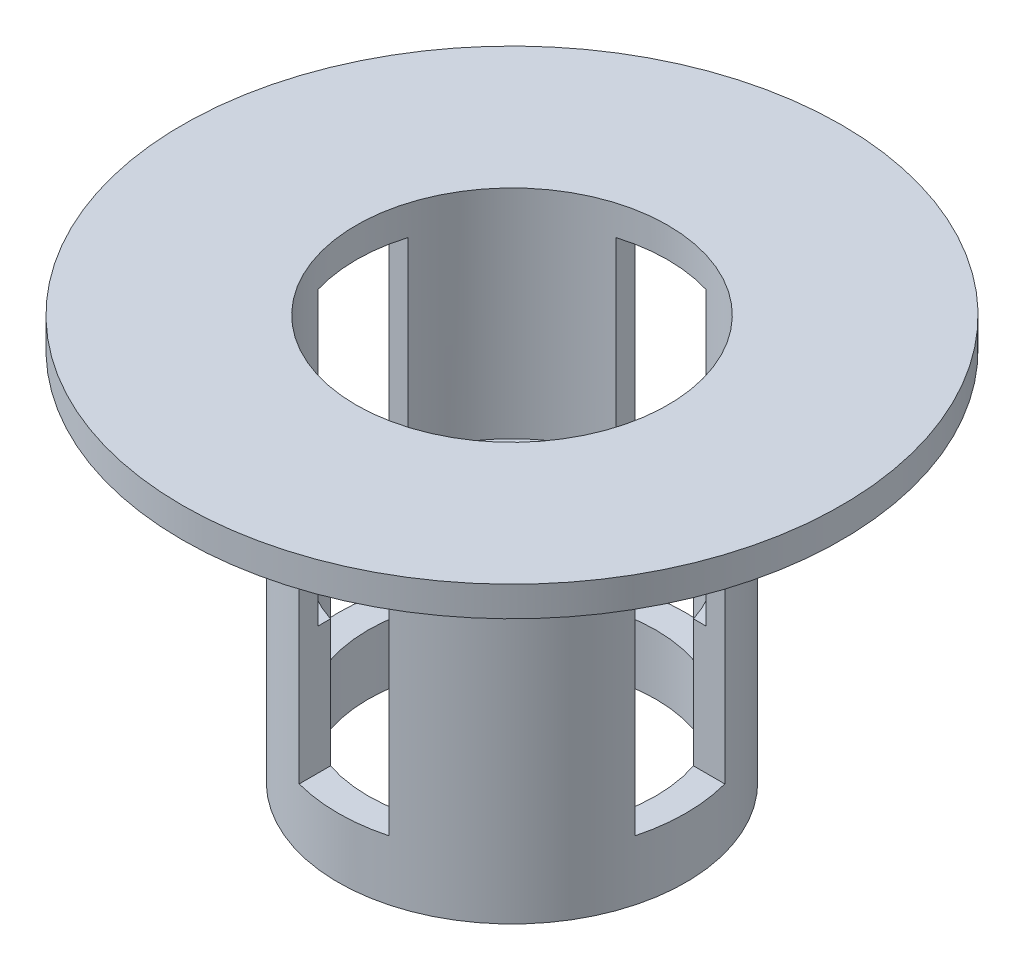
from build123d import *
from build123d.topology import SkipClean

# Parameters (mm, degrees)
SKETCH1_R          = 13.97
SKETCH1_R_2        = 6.604
STABILIZER_DEPTH   = 1.27
LARGE_START        = 7.9375
SKETCH2_R          = 7.366
SKETCH2_R_2        = 6.604
LARGE_END_DEPTH    = 7.9375
SMALL_START        = 7.9375
SKETCH3_R          = 7.366
SKETCH3_R_2        = 6.096
SMALL_END_DEPTH    = 7.9375
SKETCH5_W          = 3.81
SKETCH5_H          = 13.335
CUT_EXTRUDE1_DEPTH = 31.730063798
SKETCH7_W          = 3.81
SKETCH7_H          = 13.335
CUT_EXTRUDE2_DEPTH = 31.730063798


with BuildPart() as part:
    # Sketch1 → Stabilizer (new body)
    with BuildSketch(Plane(origin=(0, 0, 0), x_dir=(1, 0, 0), z_dir=(0, 1, 0))):
        Circle(SKETCH1_R)
        Circle(SKETCH1_R_2, mode=Mode.SUBTRACT)
    extrude(amount=STABILIZER_DEPTH)

    # Sketch2 → Large End (add)
    with SkipClean():  # the faces are left unmerged after this step: merging them gives an invalid solid
        with BuildSketch(Plane(origin=(0, 0, 0), x_dir=(-1, 0, 0), z_dir=(0, -1, 0)).offset(LARGE_START)):
            Circle(SKETCH2_R)
            Circle(SKETCH2_R_2, mode=Mode.SUBTRACT)
        extrude(amount=-LARGE_END_DEPTH)

    # Sketch3 → Small End (add)
    with SkipClean():  # the faces are left unmerged after this step: merging them gives an invalid solid
        with BuildSketch(Plane(origin=(0, -7.9375, 0), x_dir=(-1, 0, 0), z_dir=(0, -1, 0)).offset(SMALL_START)):
            Circle(SKETCH3_R)
            Circle(SKETCH3_R_2, mode=Mode.SUBTRACT)
        extrude(amount=-SMALL_END_DEPTH)

    # Sketch5 → Cut-Extrude1 (cut, through all)
    with SkipClean():  # the faces are left unmerged after this step: merging them gives an invalid solid
        with BuildSketch(Plane(origin=(0, -15.875, 7.366), x_dir=(1, 0, 0), z_dir=(0, 0, 1))):
            with Locations((0, 9.2075)):
                Rectangle(SKETCH5_W, SKETCH5_H)
        extrude(amount=-CUT_EXTRUDE1_DEPTH, mode=Mode.SUBTRACT)

    # Sketch7 → Cut-Extrude2 (cut, through all)
    with SkipClean():  # the faces are left unmerged after this step: merging them gives an invalid solid
        with BuildSketch(Plane(origin=(7.366, -15.875, 0), x_dir=(0, 0, -1), z_dir=(1, 0, 0))):
            with Locations((0, 9.2075)):
                Rectangle(SKETCH7_W, SKETCH7_H)
        extrude(amount=-CUT_EXTRUDE2_DEPTH, mode=Mode.SUBTRACT)
    add(part.part.scale(1), mode=Mode.REPLACE)  # the faces are merged on a copy


solid = part.part
